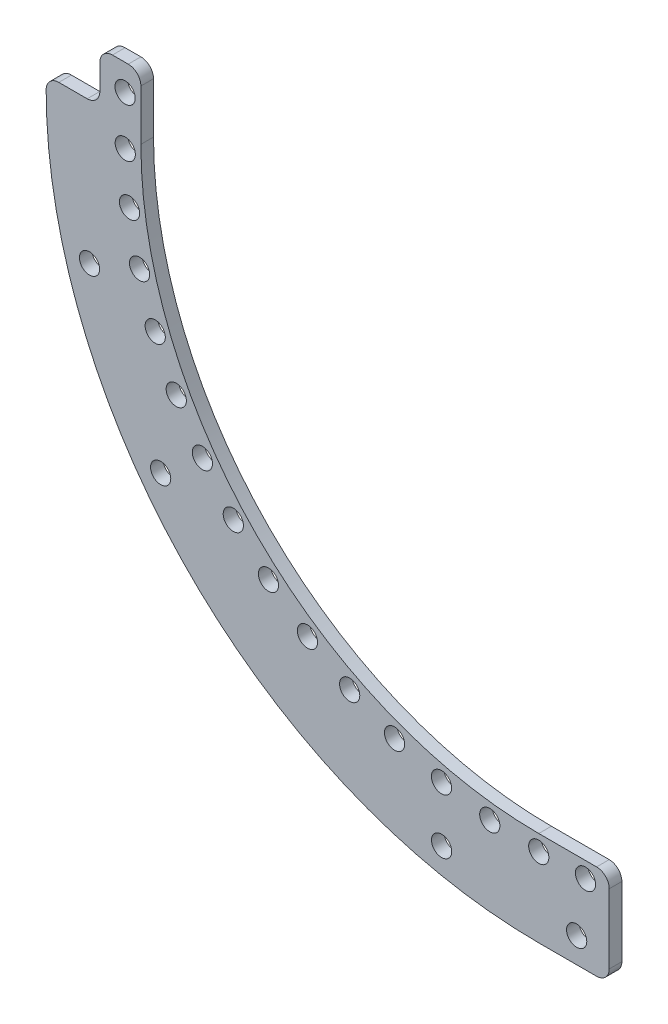
from build123d import *

# Parameters (mm, degrees)
SKETCH_2_R          = 1.6
EXTRUDE_1_DEPTH     = 2
SKETCH_4_W          = 8.5
SKETCH_4_H          = 8
CUT_EXTRUDE_1_DEPTH = 3
SKETCH_6_R          = 1.6
CUT_EXTRUDE_2_DEPTH = 10
FILLET_1_R          = 2
FILLET_2_R          = 2


with BuildPart() as part:
    # 草图2 → 凸台-拉伸1 (new body)
    with BuildSketch(Plane.XY):
        with BuildLine():
            Line((-162.154590294, 76.5), (-162.154590294, 66.5))
            ThreePointArc((-162.154590294, 66.5), (-143.702317509, 21.952272785), (-99.154590294, 3.5))
            Line((-99.154590294, 3.5), (-88, 3.5))
            Line((-88, 3.5), (-88, -11.5))
            Line((-88, -11.5), (-99.154590294, -11.5))
            ThreePointArc((-99.154590294, -11.5), (-154.308919227, 11.345671067), (-177.154590294, 66.5))
            Line((-177.154590294, 66.5), (-177.154590294, 76.5))
            Line((-177.154590294, 76.5), (-162.154590294, 76.5))
        make_face()
        with Locations((-91.754590294, 1)):
            Circle(SKETCH_2_R, mode=Mode.SUBTRACT)
        with Locations((-99.154590294, 1)):
            Circle(SKETCH_2_R, mode=Mode.SUBTRACT)
        with Locations((-106.910050218, 1.460759219)):
            Circle(SKETCH_2_R, mode=Mode.SUBTRACT)
        with Locations((-114.556398703, 2.836554462)):
            Circle(SKETCH_2_R, mode=Mode.SUBTRACT)
        with Locations((-121.986059394, 5.108029688)):
            Circle(SKETCH_2_R, mode=Mode.SUBTRACT)
        with Locations((-129.094504517, 8.243227549)):
            Circle(SKETCH_2_R, mode=Mode.SUBTRACT)
        with Locations((-135.781725472, 12.198038998)):
            Circle(SKETCH_2_R, mode=Mode.SUBTRACT)
        with Locations((-141.953639856, 16.916823855)):
            Circle(SKETCH_2_R, mode=Mode.SUBTRACT)
        with Locations((-147.523415105, 22.333193613)):
            Circle(SKETCH_2_R, mode=Mode.SUBTRACT)
        with Locations((-152.412690143, 28.370945455)):
            Circle(SKETCH_2_R, mode=Mode.SUBTRACT)
        with Locations((-156.552677837, 34.945134346)):
            Circle(SKETCH_2_R, mode=Mode.SUBTRACT)
        with Locations((-159.885132769, 41.963268131)):
            Circle(SKETCH_2_R, mode=Mode.SUBTRACT)
        with Locations((-162.363170682, 49.326608799)):
            Circle(SKETCH_2_R, mode=Mode.SUBTRACT)
        with Locations((-163.951928103, 56.931561629)):
            Circle(SKETCH_2_R, mode=Mode.SUBTRACT)
        with Locations((-164.62905283, 64.671132664)):
            Circle(SKETCH_2_R, mode=Mode.SUBTRACT)
        with Locations((-164.654590294, 72.371090315)):
            Circle(SKETCH_2_R, mode=Mode.SUBTRACT)
    extrude(amount=EXTRUDE_1_DEPTH)

    # 草图4 → 切除-拉伸1 (cut)
    with BuildSketch(Plane.XY.offset(2)):
        with Locations((-172.904590294, 72.5)):
            Rectangle(SKETCH_4_W, SKETCH_4_H)
    extrude(amount=-CUT_EXTRUDE_1_DEPTH, mode=Mode.SUBTRACT)

    # 草图6 → 切除-拉伸2 (cut)
    with BuildSketch(Plane.XY.offset(2)):
        with Locations((-170.287955794, 46.10283567)):
            Circle(SKETCH_6_R)
        with Locations((-159.021847878, 23.00389133)):
            Circle(SKETCH_6_R)
        with Locations((-114.540055415, -5.882922454)):
            Circle(SKETCH_6_R)
        with Locations((-93.154590294, -7.5)):
            Circle(SKETCH_6_R)
    extrude(amount=-CUT_EXTRUDE_2_DEPTH, mode=Mode.SUBTRACT)

    # 圆角1
    fillet_1_edges = [part.edges().sort_by_distance(p)[0] for p in [
        (-168.654590294, 68.5, 1),
    ]]
    fillet(fillet_1_edges, radius=FILLET_1_R)

    # 圆角2
    fillet_2_edges = [part.edges().sort_by_distance(p)[0] for p in [
        (-168.654590294, 76.5, 1),
        (-162.154590294, 76.5, 1),
        (-88, 3.5, 1),
        (-88, -11.5, 1),
        (-177.154590294, 68.5, 1),
    ]]
    fillet(fillet_2_edges, radius=FILLET_2_R - 0.0001)  # a hair under: the kernel refuses the full size


solid = part.part
